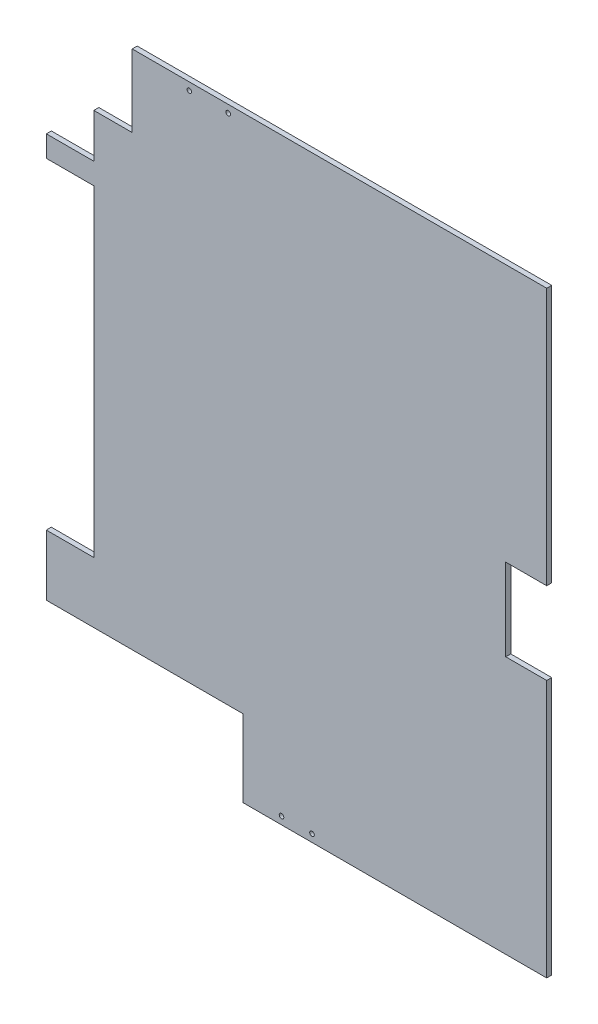
from build123d import *

# Parameters (mm, degrees)
BOSS_EXTRUDE1_DEPTH     = 3.3
SKETCH2_R               = 1.5
CUT_EXTRUDE1_DEPTH      = 453.205952877
CUT_EXTRUDE2_DEPTH      = 455.953272433
CUT_EXTRUDE2_DEPTH_BACK = 455.953272433
SKETCH3_W               = 24.5
SKETCH3_H               = 54
SKETCH4_W               = 26.984189883
SKETCH4_H               = 54
CUT_EXTRUDE3_DEPTH      = 10


with BuildPart() as part:
    # Sketch1 → Boss-Extrude1 (new body)
    with BuildSketch(Plane.XY):
        Polygon((-5.782297403, 1), (-5.782297403, -13), (25.5, -13), (25.5, -225), (-5.82455923, -225), (-5.82455923, -265), (123.748117859, -265), (123.748117859, -315.7), (323.748117859, -315.7), (323.748117859, 77.7), (50.748117859, 77.7), (50.748117859, 30), (25.5, 30), (25.5, 1), align=None)
    extrude(amount=BOSS_EXTRUDE1_DEPTH)

    # Sketch2 → Cut-Extrude1 (cut, through all)
    with BuildSketch(Plane(origin=(0, 0, 0), x_dir=(-1, 0, 0), z_dir=(0, 0, -1))):
        with Locations((-113.998383462, 72.7)):
            Circle(SKETCH2_R)
        with Locations((-88.397045893, 72.7)):
            Circle(SKETCH2_R)
        with Locations((-169.168895948, -310.7)):
            Circle(SKETCH2_R)
        with Locations((-149.084447974, -310.7)):
            Circle(SKETCH2_R)
    extrude(amount=-CUT_EXTRUDE1_DEPTH, mode=Mode.SUBTRACT)

    # Sketch3 → Cut-Extrude2 (cut, two sides: drawn at the far end of the back side and taken through both)
    with BuildSketch(Plane(origin=(119.391473557, 0, 256.035841294), x_dir=(0.9063077870366519, 0, -0.42261826174069517), z_dir=(0.42261826174069517, 0, 0.9063077870366519)).offset(-CUT_EXTRUDE2_DEPTH_BACK)):
        with Locations((281.209458836, -119)):
            Rectangle(SKETCH3_W, SKETCH3_H)
    extrude(amount=CUT_EXTRUDE2_DEPTH + CUT_EXTRUDE2_DEPTH_BACK, mode=Mode.SUBTRACT)

    # Sketch4 → Cut-Extrude3 (cut)
    with BuildSketch(Plane(origin=(0, 0, 0), x_dir=(-1, 0, 0), z_dir=(0, 0, -1))):
        with Locations((-310.256022917, -119)):
            Rectangle(SKETCH4_W, SKETCH4_H)
    extrude(amount=-CUT_EXTRUDE3_DEPTH, mode=Mode.SUBTRACT)


solid = part.part
